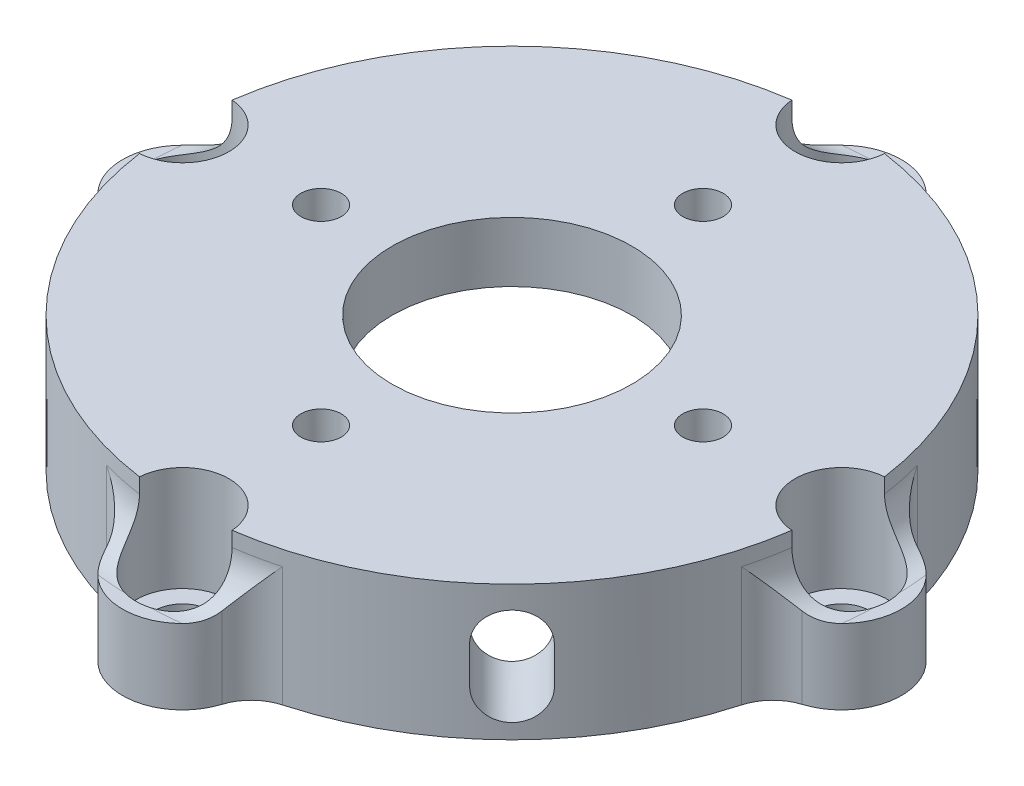
from build123d import *

# Parameters (mm, degrees)
SKETCH1_R                      = 22
SKETCH1_R_2                    = 8
BOSS_EXTRUDE1_DEPTH            = 4
SKETCH2_R                      = 22
SKETCH2_R_2                    = 17
BOSS_EXTRUDE4_DEPTH            = 5
SKETCH4_R                      = 4
SKETCH4_R_2                    = 3.1
BOSS_EXTRUDE2_DEPTH            = 5
BOSS_EXTRUDE3_START            = -2
BOSS_EXTRUDE3_DEPTH            = 2
CUT_EXTRUDE3_START             = -2
SKETCH4_6_R                    = 3.1
SKETCH4_6_R_2                  = 1.85
CUT_EXTRUDE3_DEPTH             = 34.227829908
SKETCH4_7_R                    = 1.85
CUT_EXTRUDE4_DEPTH             = 36.227829908
CUT_EXTRUDE5_REACH             = 37.228
SKETCH5_R                      = 1.35
CUT_EXTRUDE7_START             = -2
SKETCH5_4_R                    = 1.35
CUT_EXTRUDE7_DEPTH             = 2
FILLET4_START                  = -9
FILLET4_DEPTH                  = 5.53934
FILLET4_START_2                = -4
FILLET4_2_DEPTH                = 3.0000001
CIRPATTERN3_COUNT              = 4
CUT_EXTRUDE8_REACH             = 48.661
CUT_EXTRUDE8_DIRECTION_2_REACH = 48.661


with BuildPart() as part:
    # Sketch1 → Boss-Extrude1 (new body)
    with BuildSketch(Plane(origin=(0, 0, 0), x_dir=(1, 0, 0), z_dir=(0, 1, 0))):
        with Locations(Location((0, 0, 0), (0, 0, 270))):
            Circle(SKETCH1_R)
        with Locations(Location((0, 0, 0), (0, 0, 270))):
            Circle(SKETCH1_R_2, mode=Mode.SUBTRACT)
    extrude(amount=-BOSS_EXTRUDE1_DEPTH)

    # Sketch2 → Boss-Extrude4 (add)
    with BuildSketch(Plane.XZ.offset(4)):
        with Locations(Location((0, 0, 0), (0, 0, 90))):
            Circle(SKETCH2_R)
        with Locations(Location((0, 0, 0), (0, 0, 270))):
            Circle(SKETCH2_R_2, mode=Mode.SUBTRACT)
    extrude(amount=BOSS_EXTRUDE4_DEPTH)

    # Sketch4 → Boss-Extrude2 (add)
    with BuildSketch(Plane.XZ.offset(9)):
        with Locations((0, 22)):
            Circle(SKETCH4_R)
        with Locations((0, 22)):
            Circle(SKETCH4_R_2, mode=Mode.SUBTRACT)
    boss_extrude2 = extrude(amount=-BOSS_EXTRUDE2_DEPTH)

    # Sketch4<5> → Boss-Extrude3 (add)
    with BuildSketch(Plane.XZ.offset(9).offset(BOSS_EXTRUDE3_START)):
        with BuildLine():
            ThreePointArc((-1.848364043, 21.922215909), (-2.4713307, 21.860753065), (-3.092296472, 21.781590909))
            ThreePointArc((-3.092296472, 21.781590909), (0, 18.9), (3.092296472, 21.781590909))
            ThreePointArc((3.092296472, 21.781590909), (2.4713307, 21.860753065), (1.848364043, 21.922215909))
            ThreePointArc((1.848364043, 21.922215909), (0, 20.15), (-1.848364043, 21.922215909))
        make_face()
        with BuildLine():
            ThreePointArc((3.092296472, 21.781590909), (3.098073519, 21.890727548), (3.1, 22))
            ThreePointArc((3.1, 22), (-0.109272452, 25.098073519), (-3.092296472, 21.781590909))
            ThreePointArc((-3.092296472, 21.781590909), (-2.4713307, 21.860753065), (-1.848364043, 21.922215909))
            ThreePointArc((-1.848364043, 21.922215909), (-0.038900646, 23.849590966), (1.85, 22))
            ThreePointArc((1.85, 22), (1.849590966, 21.961099354), (1.848364043, 21.922215909))
            ThreePointArc((1.848364043, 21.922215909), (2.4713307, 21.860753065), (3.092296472, 21.781590909))
        make_face()
    boss_extrude3 = extrude(amount=BOSS_EXTRUDE3_DEPTH)

    # Sketch4<6> → Cut-Extrude3 (cut, through all)
    with BuildSketch(Plane.XZ.offset(9).offset(CUT_EXTRUDE3_START)):
        with Locations(Location((0, 22, 0), (0, 0, 270))):
            Circle(SKETCH4_6_R)
        with Locations((0, 22)):
            Circle(SKETCH4_6_R_2, mode=Mode.SUBTRACT)
    cut_extrude3 = extrude(amount=-CUT_EXTRUDE3_DEPTH, mode=Mode.SUBTRACT)

    # Sketch4<7> → Cut-Extrude4 (cut, through all)
    with BuildSketch(Plane.XZ.offset(9)):
        with Locations(Location((0, 22, 0), (0, 0, 270))):
            Circle(SKETCH4_7_R)
    cut_extrude4 = extrude(amount=-CUT_EXTRUDE4_DEPTH, mode=Mode.SUBTRACT)

    # Sketch5 → Cut-Extrude5 (cut, up to next)
    with BuildSketch(Plane(origin=(0, 0, 0), x_dir=(1, 0, 0), z_dir=(0, 1, 0)), mode=Mode.PRIVATE) as cut_extrude5_sk1:
        with Locations(Location((0, 12.75, 0), (0, 0, 270))):
            Circle(SKETCH5_R)
    cut_extrude5_tool1 = extrude(cut_extrude5_sk1.sketch, amount=-CUT_EXTRUDE5_REACH, mode=Mode.PRIVATE) & part.part
    cut_extrude5 = cut_extrude5_tool1.solids().sort_by_distance((0, 0, -12.75))[0]
    add(cut_extrude5, mode=Mode.SUBTRACT)

    # Sketch5<4> → Cut-Extrude7 (cut)
    with BuildSketch(Plane(origin=(0, 0, 0), x_dir=(1, 0, 0), z_dir=(0, 1, 0)).offset(CUT_EXTRUDE7_START)):
        Polygon((2.367136104, 12.75), (1.183568052, 14.8), (-1.183568052, 14.8), (-2.367136104, 12.75), (-1.183568052, 10.7), (1.183568052, 10.7), align=None)
        with Locations(Location((0, 12.75, 0), (0, 0, 270))):
            Circle(SKETCH5_4_R, mode=Mode.SUBTRACT)
    cut_extrude7 = extrude(amount=-CUT_EXTRUDE7_DEPTH, mode=Mode.SUBTRACT)

    # Fillet4: read off the stored shape, not the designer's step
    # Fillet4 outline → Fillet4 (add)
    with BuildSketch(Plane(origin=(0, 0, 0), x_dir=(1, 0, 0), z_dir=(0, 1, 0)).offset(FILLET4_START)):
        with BuildLine():
            ThreePointArc((5.878775383, -21.2), (4.935930561, -21.439136865), (3.983436782, -21.636363636))
            ThreePointArc((3.983436782, -21.636363636), (3.977486195, -22.423796615), (3.817386612, -23.194805195))
            ThreePointArc((3.817386612, -23.194805195), (4.594209362, -21.935057112), (5.878775383, -21.2))
        make_face()
        with BuildLine():
            ThreePointArc((-3.817386612, -23.194805195), (-3.977486195, -22.423796615), (-3.983436782, -21.636363636))
            ThreePointArc((-3.983436782, -21.636363636), (-4.935930561, -21.439136865), (-5.878775383, -21.2))
            ThreePointArc((-5.878775383, -21.2), (-4.594209362, -21.935057112), (-3.817386612, -23.194805195))
        make_face()
    fillet4 = extrude(amount=FILLET4_DEPTH)

    # Fillet4 2 outline → Fillet4 2 (add)
    with BuildSketch(Plane(origin=(0, 0, 0), x_dir=(1, 0, 0), z_dir=(0, 1, 0)).offset(FILLET4_START_2)):
        with BuildLine():
            ThreePointArc((3.092296472, -21.781590909), (0, -25.1), (-3.092296472, -21.781590909))
            ThreePointArc((-3.092296472, -21.781590909), (-4.494952119, -21.535909673), (-5.878775383, -21.2))
            ThreePointArc((-5.878775383, -21.2), (-4.594209362, -21.935057112), (-3.817386612, -23.194805195))
            ThreePointArc((-3.817386612, -23.194805195), (0, -26), (3.817386612, -23.194805195))
            ThreePointArc((3.817386612, -23.194805195), (4.594209362, -21.935057112), (5.878775383, -21.2))
            ThreePointArc((5.878775383, -21.2), (4.494952119, -21.535909673), (3.092296472, -21.781590909))
        make_face()
    fillet4_2 = extrude(amount=FILLET4_2_DEPTH)

    # Fillet4 3 outline → Fillet4 3 (revolve, cut)
    with BuildSketch(Plane.XY):
        with BuildLine():
            ThreePointArc((22, -1), (22.878679656, -3.121320344), (25, -4))
            Line((25, -4), (26, -4))
            Line((26, -4), (26, -0.9999999))
            Line((26, -0.9999999), (22, -1))
        make_face()
    fillet4_3 = revolve(axis=Axis((0, 0, 0), (0, 1, 0)), mode=Mode.SUBTRACT)

    # CirPattern3: Boss-Extrude2, Boss-Extrude3, Cut-Extrude3, Cut-Extrude4, Cut-Extrude5, Cut-Extrude7, Fillet4, Fillet4 2, Fillet4 3 ×4 about axis
    cirpattern3_axis = Axis((0, 0, 0), (0, 1, 0))
    add([boss_extrude2.rotate(cirpattern3_axis, i * 360 / CIRPATTERN3_COUNT) for i in range(1, CIRPATTERN3_COUNT)])
    add([boss_extrude3.rotate(cirpattern3_axis, i * 360 / CIRPATTERN3_COUNT) for i in range(1, CIRPATTERN3_COUNT)])
    add([cut_extrude3.rotate(cirpattern3_axis, i * 360 / CIRPATTERN3_COUNT) for i in range(1, CIRPATTERN3_COUNT)], mode=Mode.SUBTRACT)
    add([cut_extrude4.rotate(cirpattern3_axis, i * 360 / CIRPATTERN3_COUNT) for i in range(1, CIRPATTERN3_COUNT)], mode=Mode.SUBTRACT)
    add([cut_extrude5.rotate(cirpattern3_axis, i * 360 / CIRPATTERN3_COUNT) for i in range(1, CIRPATTERN3_COUNT)], mode=Mode.SUBTRACT)
    add([cut_extrude7.rotate(cirpattern3_axis, i * 360 / CIRPATTERN3_COUNT) for i in range(1, CIRPATTERN3_COUNT)], mode=Mode.SUBTRACT)
    add([fillet4.rotate(cirpattern3_axis, i * 360 / CIRPATTERN3_COUNT) for i in range(1, CIRPATTERN3_COUNT)])
    add([fillet4_2.rotate(cirpattern3_axis, i * 360 / CIRPATTERN3_COUNT) for i in range(1, CIRPATTERN3_COUNT)])
    add([fillet4_3.rotate(cirpattern3_axis, i * 360 / CIRPATTERN3_COUNT) for i in range(1, CIRPATTERN3_COUNT)], mode=Mode.SUBTRACT)

    # Sketch7 → Cut-Extrude8 (cut, up to next)
    with BuildSketch(Plane(origin=(6.375, 0, 6.375), x_dir=(0.7071067811865487, 0, -0.7071067811865465), z_dir=(0.7071067811865465, 0, 0.7071067811865487)), mode=Mode.PRIVATE) as cut_extrude8_sk1:
        with BuildLine():
            Line((-2, -6), (-2, -3.5))
            ThreePointArc((-2, -3.5), (0, -1.5), (2, -3.5))
            Line((2, -3.5), (2, -6))
            ThreePointArc((2, -6), (0, -8), (-2, -6))
        make_face()
    cut_extrude8_tool1 = extrude(cut_extrude8_sk1.sketch, amount=CUT_EXTRUDE8_REACH, mode=Mode.PRIVATE) & part.part
    add(cut_extrude8_tool1.solids().sort_by_distance((6.375, -4.75, 6.375))[0], mode=Mode.SUBTRACT)

    # Sketch7 → Cut-Extrude8 direction 2 (cut, up to next)
    with BuildSketch(Plane(origin=(6.375, 0, 6.375), x_dir=(0.7071067811865487, 0, -0.7071067811865465), z_dir=(0.7071067811865465, 0, 0.7071067811865487)), mode=Mode.PRIVATE) as cut_extrude8_direction_2_sk1:
        with BuildLine():
            Line((-2, -6), (-2, -3.5))
            ThreePointArc((-2, -3.5), (0, -1.5), (2, -3.5))
            Line((2, -3.5), (2, -6))
            ThreePointArc((2, -6), (0, -8), (-2, -6))
        make_face()
    cut_extrude8_direction_2_tool1 = extrude(cut_extrude8_direction_2_sk1.sketch, amount=-CUT_EXTRUDE8_DIRECTION_2_REACH, mode=Mode.PRIVATE) & part.part
    add(cut_extrude8_direction_2_tool1.solids().sort_by_distance((6.375, -4.75, 6.375))[0], mode=Mode.SUBTRACT)


solid = part.part
